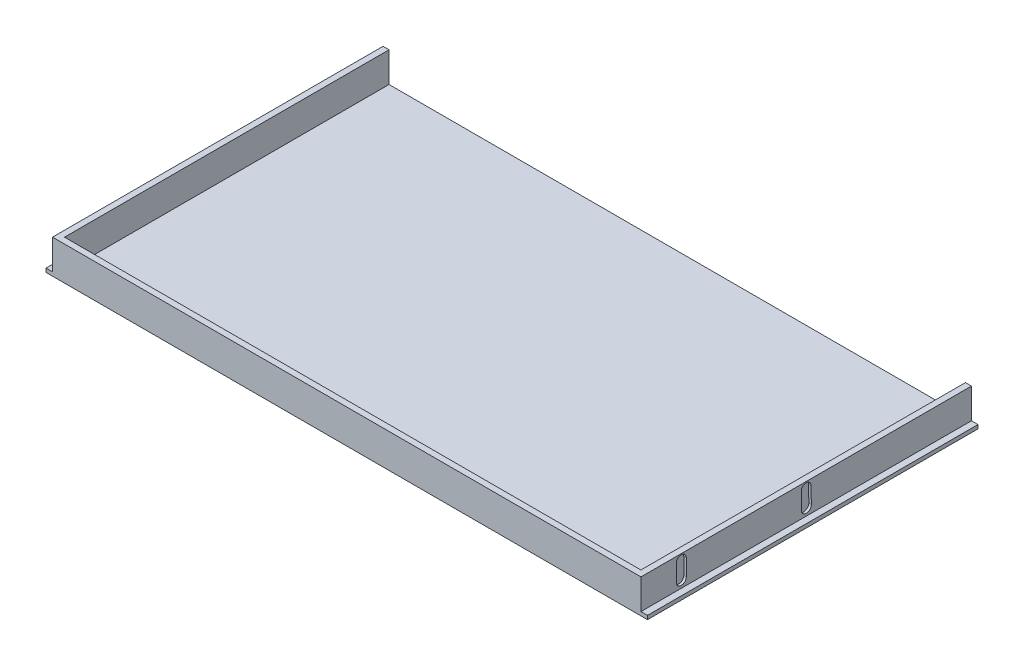
from build123d import *

# Parameters (mm, degrees)
SKETCH1_W           = 240
SKETCH1_H           = 351.15
BOSS_EXTRUDE3_DEPTH = 21
SKETCH5_W           = 248.975913499
SKETCH5_H           = 113.170869772
CUT_EXTRUDE5_DEPTH  = 254
CAVITY1_START       = -93.176553254
CAVITY1_DEPTH       = 230
SKETCH6_W           = 230
SKETCH6_H           = 2.384694545
CUT_EXTRUDE6_DEPTH  = 10
SKETCH7_W           = 329.692379319
SKETCH7_H           = 158.801284786
CUT_EXTRUDE8_DEPTH  = 33
CUT_EXTRUDE9_DEPTH  = 12
SKETCH15_W          = 230
SKETCH15_H          = 129.5
CUT_EXTRUDE15_DEPTH = 3.5
CUT_EXTRUDE17_DEPTH = 1
CUT_EXTRUDE18_START = -1
CUT_EXTRUDE18_DEPTH = 1
CUT_EXTRUDE19_DEPTH = 1
CUT_EXTRUDE20_START = -1
CUT_EXTRUDE20_DEPTH = 1


with BuildPart() as part:
    # Sketch1 → Boss-Extrude3 (new body)
    with BuildSketch(Plane(origin=(0, 0, 0), x_dir=(1, 0, 0), z_dir=(0, 1, 0))):
        with Locations((21.823446746, 98.176553254)):
            Rectangle(SKETCH1_W, SKETCH1_H)
    extrude(amount=BOSS_EXTRUDE3_DEPTH)

    # Sketch5 → Cut-Extrude5 (cut)
    with BuildSketch(Plane(origin=(0, 0, -54.481553254), x_dir=(-1, 0, 0), z_dir=(0, 0, -1))):
        with Locations((-20.8478358, 4.110963623)):
            Rectangle(SKETCH5_W, SKETCH5_H)
    extrude(amount=CUT_EXTRUDE5_DEPTH, mode=Mode.SUBTRACT)

    # Cavity1: read off the stored shape, not the designer's step
    # Cavity1 outline → Cavity1 (cut)
    with BuildSketch(Plane.YZ.offset(CAVITY1_START)):
        Polygon((18.5, 60.403141291), (13.5, 67.518446746), (13.5, 67.903141291), (18.5, 67.903141291), (13.5, 75.018446746), (5, 75.018446746), (5, -54.481553254), (13.5, -54.481553254), (13.5, -52.096858709), (18.5, -52.096858709), (13.5, -44.981553254), (13.5, -44.596858709), (18.5, -44.596858709), (13.5, -37.481553254), (13.5, -37.096858709), (18.5, -37.096858709), (13.5, -29.981553254), (13.5, -29.596858709), (18.5, -29.596858709), (13.5, -22.481553254), (13.5, -22.096858709), (18.5, -22.096858709), (13.5, -14.981553254), (13.5, -14.596858709), (18.5, -14.596858709), (13.5, -7.481553254), (13.5, -7.096858709), (18.5, -7.096858709), (13.5, 0.018446746), (13.5, 0.403141291), (18.5, 0.403141291), (13.5, 7.518446746), (13.5, 7.903141291), (18.5, 7.903141291), (13.5, 15.018446746), (13.5, 15.403141291), (18.5, 15.403141291), (13.5, 22.518446746), (13.5, 22.903141291), (18.5, 22.903141291), (13.5, 30.018446746), (13.5, 30.403141291), (18.5, 30.403141291), (13.5, 37.518446746), (13.5, 37.903141291), (18.5, 37.903141291), (13.5, 45.018446746), (13.5, 45.403141291), (18.5, 45.403141291), (13.5, 52.518446746), (13.5, 52.903141291), (18.5, 52.903141291), (13.5, 60.018446746), (13.5, 60.403141291), align=None)
    extrude(amount=CAVITY1_DEPTH, mode=Mode.SUBTRACT)

    # Sketch6 → Cut-Extrude6 (cut)
    with BuildSketch(Plane(origin=(0, 13.5, 0), x_dir=(-1, 0, 0), z_dir=(0, -1, 0))):
        with Locations((-21.823446746, 53.289205982)):
            Rectangle(SKETCH6_W, SKETCH6_H)
    extrude(amount=-CUT_EXTRUDE6_DEPTH, mode=Mode.SUBTRACT)

    # Sketch7 → Cut-Extrude8 (cut)
    with BuildSketch(Plane(origin=(0, 13.5, 0), x_dir=(-1, 0, 0), z_dir=(0, -1, 0))):
        with Locations((-33.84938791, -12.885366014)):
            Rectangle(SKETCH7_W, SKETCH7_H)
    extrude(amount=-CUT_EXTRUDE8_DEPTH, mode=Mode.SUBTRACT)

    # Sketch9 → Cut-Extrude9 (cut)
    with BuildSketch(Plane(origin=(0, 13.5, 0), x_dir=(1, 0, 0), z_dir=(0, 1, 0))):
        Polygon((139.223446746, 54.481553254), (139.223446746, -75.718446746), (139.223446746, -77.398446746), (141.823446746, -77.398446746), (141.823446746, 54.481553254), align=None)
        Polygon((-95.576553254, -75.718446746), (-95.576553254, -77.398446746), (-98.176553254, -77.398446746), (-98.176553254, 54.481553254), (-95.576553254, 54.481553254), align=None)
    extrude(amount=-CUT_EXTRUDE9_DEPTH, mode=Mode.SUBTRACT)

    # Sketch15 → Cut-Extrude15 (cut)
    with BuildSketch(Plane(origin=(0, 5, 0), x_dir=(1, 0, 0), z_dir=(0, 1, 0))):
        with Locations((21.823446746, -10.268446746)):
            Rectangle(SKETCH15_W, SKETCH15_H)
    extrude(amount=-CUT_EXTRUDE15_DEPTH, mode=Mode.SUBTRACT)

    # Sketch17 → Cut-Extrude17 (cut)
    with BuildSketch(Plane.ZY.offset(95.576553254)):
        with BuildLine():
            Line((9.418446746, 4.5), (9.526698687, 11.090649814))
            ThreePointArc((9.526698687, 11.090649814), (11.472572716, 13.036523843), (13.418446746, 11.090649814))
            Line((13.418446746, 11.090649814), (13.418446746, 4.5))
            ThreePointArc((13.418446746, 4.5), (11.418446746, 2.5), (9.418446746, 4.5))
        make_face()
    extrude(amount=-CUT_EXTRUDE17_DEPTH, mode=Mode.SUBTRACT)

    # Sketch16 → Cut-Extrude18 (cut)
    with BuildSketch(Plane(origin=(139.223446746, 0, 0), x_dir=(0, 0, -1), z_dir=(1, 0, 0)).offset(CUT_EXTRUDE18_START)):
        with BuildLine():
            Line((-13.418446746, 4.5), (-13.418446746, 11.090649814))
            ThreePointArc((-13.418446746, 11.090649814), (-11.472572716, 13.036523843), (-9.526698687, 11.090649814))
            Line((-9.526698687, 11.090649814), (-9.418446746, 4.5))
            ThreePointArc((-9.418446746, 4.5), (-11.418446746, 2.5), (-13.418446746, 4.5))
        make_face()
    extrude(amount=CUT_EXTRUDE18_DEPTH, mode=Mode.SUBTRACT)

    # Sketch20 → Cut-Extrude19 (cut)
    with BuildSketch(Plane(origin=(139.223446746, 0, 0), x_dir=(0, 0, -1), z_dir=(1, 0, 0))):
        with BuildLine():
            Line((-59.318446746, 4.5), (-59.318446746, 11.09))
            ThreePointArc((-59.318446746, 11.09), (-61.318446746, 13.09), (-63.318446746, 11.09))
            Line((-63.318446746, 11.09), (-63.318446746, 4.5))
            ThreePointArc((-63.318446746, 4.5), (-61.318446746, 2.5), (-59.318446746, 4.5))
        make_face()
    extrude(amount=-CUT_EXTRUDE19_DEPTH, mode=Mode.SUBTRACT)

    # Sketch18 → Cut-Extrude20 (cut)
    with BuildSketch(Plane.ZY.offset(95.576553254).offset(CUT_EXTRUDE20_START)):
        with BuildLine():
            Line((63.318446746, 4.5), (63.318446746, 11.09))
            ThreePointArc((63.318446746, 11.09), (61.318446746, 13.09), (59.318446746, 11.09))
            Line((59.318446746, 11.09), (59.318446746, 4.5))
            ThreePointArc((59.318446746, 4.5), (61.318446746, 2.5), (63.318446746, 4.5))
        make_face()
    extrude(amount=CUT_EXTRUDE20_DEPTH, mode=Mode.SUBTRACT)


solid = part.part
